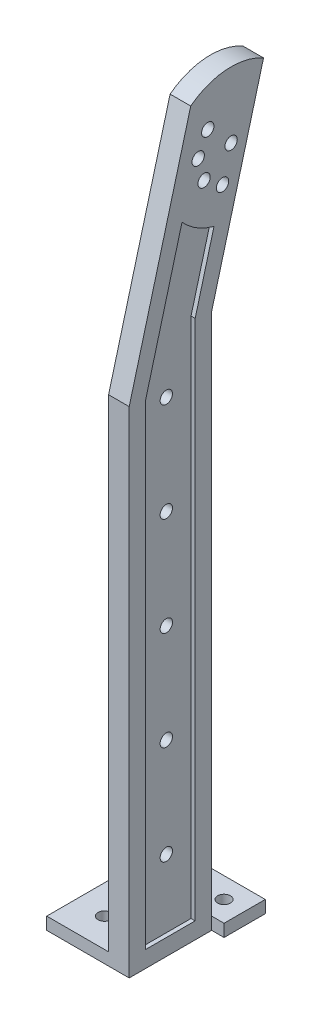
from build123d import *

# Parameters (mm, degrees)
SKETCH_1_R          = 1.5
EXTRUDE_2_DEPTH     = 5
CUT_EXTRUDE_1_DEPTH = 1
EXTRUDE_3_DEPTH     = 3
SKETCH_6_R          = 1.55
CUT_EXTRUDE_2_DEPTH = 10
SKETCH_7_W          = 3
SKETCH_7_H          = 41
EXTRUDE_4_DEPTH     = 13
EXTRUDE_5_DEPTH     = 3
SKETCH_11_R         = 1.5
CUT_EXTRUDE_4_DEPTH = 181.916806655
SKETCH_10_R         = 1.6
CUT_EXTRUDE_3_DEPTH = 3


with BuildPart() as part:
    # 草图1 → 凸台-拉伸2 (new body)
    with BuildSketch(Plane(origin=(0, 0, 0), x_dir=(0, 0, -1), z_dir=(1, 0, 0))):
        with BuildLine():
            Line((-10, 0), (10, 0))
            Line((10, 0), (10, 130))
            Line((10, 130), (22.580255424, 176.950152413))
            ThreePointArc((22.580255424, 176.950152413), (13.557589865, 178.980034876), (4.918920693, 175.678170019))
            Line((4.918920693, 175.678170019), (-10, 120))
            Line((-10, 120), (-10, 0))
        make_face()
        with Locations((0, 116.48228672)):
            Circle(SKETCH_1_R, mode=Mode.SUBTRACT)
        with Locations((14.706944713, 163.021370038)):
            Circle(SKETCH_1_R, mode=Mode.SUBTRACT)
        with Locations((12.636392352, 155.293963427)):
            Circle(SKETCH_1_R, mode=Mode.SUBTRACT)
        with Locations((0, 92.48228672)):
            Circle(SKETCH_1_R, mode=Mode.SUBTRACT)
        with Locations((0, 68.48228672)):
            Circle(SKETCH_1_R, mode=Mode.SUBTRACT)
        with Locations((0, 44.48228672)):
            Circle(SKETCH_1_R, mode=Mode.SUBTRACT)
        with Locations((0, 20.48228672)):
            Circle(SKETCH_1_R, mode=Mode.SUBTRACT)
        with Locations((8.153728359, 158.432758547)):
            Circle(SKETCH_1_R, mode=Mode.SUBTRACT)
        with Locations((6.737387128, 163.71861598)):
            Circle(SKETCH_1_R, mode=Mode.SUBTRACT)
        with Locations((9.050090463, 168.678224287)):
            Circle(SKETCH_1_R, mode=Mode.SUBTRACT)
    extrude(amount=-EXTRUDE_2_DEPTH)

    # 草图4 → 切除-拉伸1 (cut)
    with BuildSketch(Plane(origin=(0, 0, 0), x_dir=(0, 0, -1), z_dir=(1, 0, 0))):
        with BuildLine():
            Line((2.803784521, 152.329561142), (-6, 119.47339001))
            Line((-6, 119.47339001), (-6, 4))
            Line((-6, 4), (6, 4))
            Line((6, 4), (6, 130.52660999))
            Line((6, 130.52660999), (10.565839991, 147.566556817))
            ThreePointArc((10.565839991, 147.566556817), (6.338781133, 149.384147509), (2.803784521, 152.329561142))
        make_face()
    extrude(amount=-CUT_EXTRUDE_1_DEPTH, mode=Mode.SUBTRACT)

    # 草图5 → 凸台-拉伸3 (add)
    with BuildSketch(Plane(origin=(0, 0, 0), x_dir=(-1, 0, 0), z_dir=(0, -1, 0))):
        Polygon((0, -10), (20, -10), (20, 10), (20, 20), (-3, 20), (-3, 10), (0, 10), align=None)
    extrude(amount=-EXTRUDE_3_DEPTH)

    # 草图6 → 切除-拉伸2 (cut)
    with BuildSketch(Plane.XZ):
        with Locations((-13, 3)):
            Circle(SKETCH_6_R)
        with Locations((-2, -15)):
            Circle(SKETCH_6_R)
        with Locations((-13, -11)):
            Circle(SKETCH_6_R)
    extrude(amount=-CUT_EXTRUDE_2_DEPTH, mode=Mode.SUBTRACT)

    # 草图7 → 凸台-拉伸4 (add)
    with BuildSketch(Plane.ZY.offset(5)):
        with Locations((-5.3, 23.5)):
            Rectangle(SKETCH_7_W, SKETCH_7_H)
    extrude(amount=EXTRUDE_4_DEPTH)

    # 草图9 → 凸台-拉伸5 (add)
    with BuildSketch(Plane(origin=(0, 0, -6.8), x_dir=(-1, 0, 0), z_dir=(0, 0, -1))):
        with BuildLine():
            Line((5, 44), (18, 44))
            ThreePointArc((18, 44), (11.5, 50.5), (5, 44))
        make_face()
    extrude(amount=-EXTRUDE_5_DEPTH)

    # 草图11 → 切除-拉伸4 (cut, through all)
    with BuildSketch(Plane(origin=(0, 0, -6.8), x_dir=(-1, 0, 0), z_dir=(0, 0, -1))):
        with Locations((11.5, 44)):
            Circle(SKETCH_11_R)
        with Locations((11.5, 7)):
            Circle(SKETCH_11_R)
    extrude(amount=-CUT_EXTRUDE_4_DEPTH, mode=Mode.SUBTRACT)

    # 草图10 → 切除-拉伸3 (cut)
    with BuildSketch(Plane(origin=(0, 0, -6.8), x_dir=(-1, 0, 0), z_dir=(0, 0, -1))):
        with Locations((11.5, 44)):
            Circle(SKETCH_10_R)
        with Locations((11.5, 7)):
            Circle(SKETCH_10_R)
    extrude(amount=-CUT_EXTRUDE_3_DEPTH, mode=Mode.SUBTRACT)


solid = part.part
